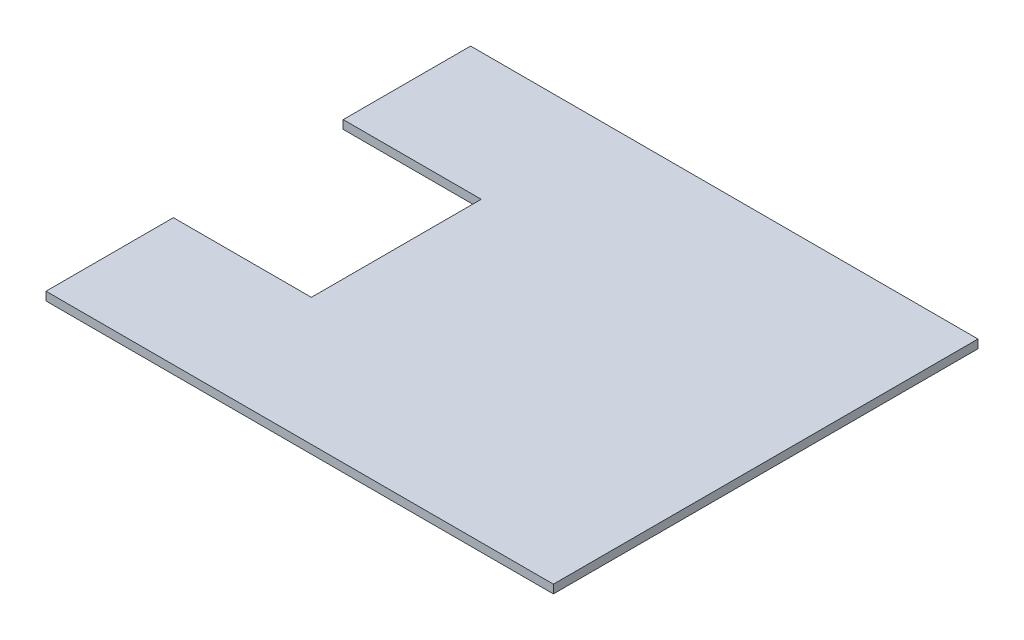
from build123d import *

# Parameters (mm, degrees)
SALIENTE_EXTRUIR1_DEPTH = 4


with BuildPart() as part:
    # Croquis1 → Saliente-Extruir1 (new body)
    with BuildSketch(Plane(origin=(0, 0, 0), x_dir=(1, 0, 0), z_dir=(0, 1, 0))):
        Polygon((119.5, -100), (-119.5, -100), (-119.5, -40), (-54.5, -40), (-54.5, 40), (-119.5, 40), (-119.5, 100), (119.5, 100), align=None)
    extrude(amount=SALIENTE_EXTRUIR1_DEPTH)


solid = part.part
